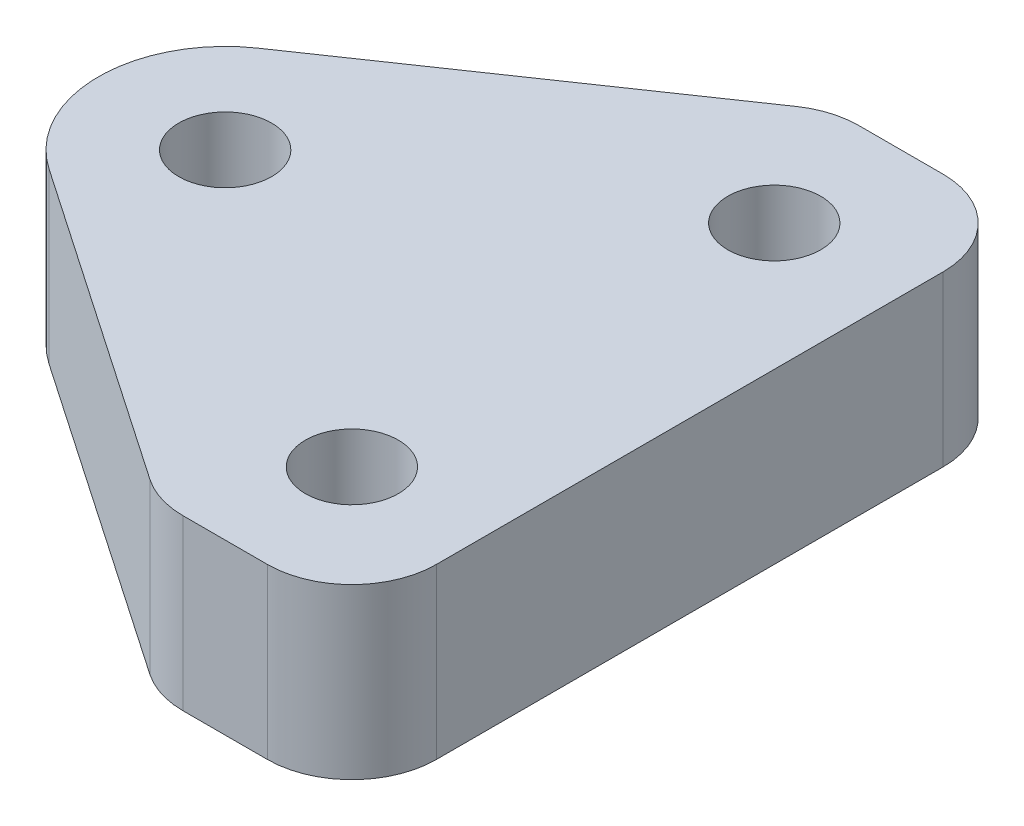
from build123d import *

# Parameters (mm, degrees)
BOSS_EXTRUDE1_DEPTH  = 10
M5_CLEARANCE_HOLE1_D = 5.5


with BuildPart() as part:
    # Sketch1 → Boss-Extrude1 (new body)
    with BuildSketch(Plane(origin=(0, 0, 0), x_dir=(1, 0, 0), z_dir=(0, 1, 0))):
        with BuildLine():
            Line((-4.234491912, -6.190240564), (14.677005392, -19.126827043))
            ThreePointArc((14.677005392, -19.126827043), (16.022524994, -19.776721429), (17.5, -20))
            Line((17.5, -20), (22.5, -20))
            ThreePointArc((22.5, -20), (26.035533906, -18.535533906), (27.5, -15))
            Line((27.5, -15), (27.5, 15))
            ThreePointArc((27.5, 15), (26.035533906, 18.535533906), (22.5, 20))
            Line((22.5, 20), (17.5, 20))
            ThreePointArc((17.5, 20), (16.022524994, 19.776721429), (14.677005392, 19.126827043))
            Line((14.677005392, 19.126827043), (-4.234491912, 6.190240564))
            ThreePointArc((-4.234491912, 6.190240564), (-7.5, 0), (-4.234491912, -6.190240564))
        make_face()
    extrude(amount=BOSS_EXTRUDE1_DEPTH)

    # M5 Clearance Hole1 (through all)
    with Locations(Plane(origin=(0, 10, 0), x_dir=(1, 0, 0), z_dir=(0, 1, 0))):
        with Locations((0, 0), (20, 12.5), (20, -12.5)):
            Hole(M5_CLEARANCE_HOLE1_D / 2)


solid = part.part
